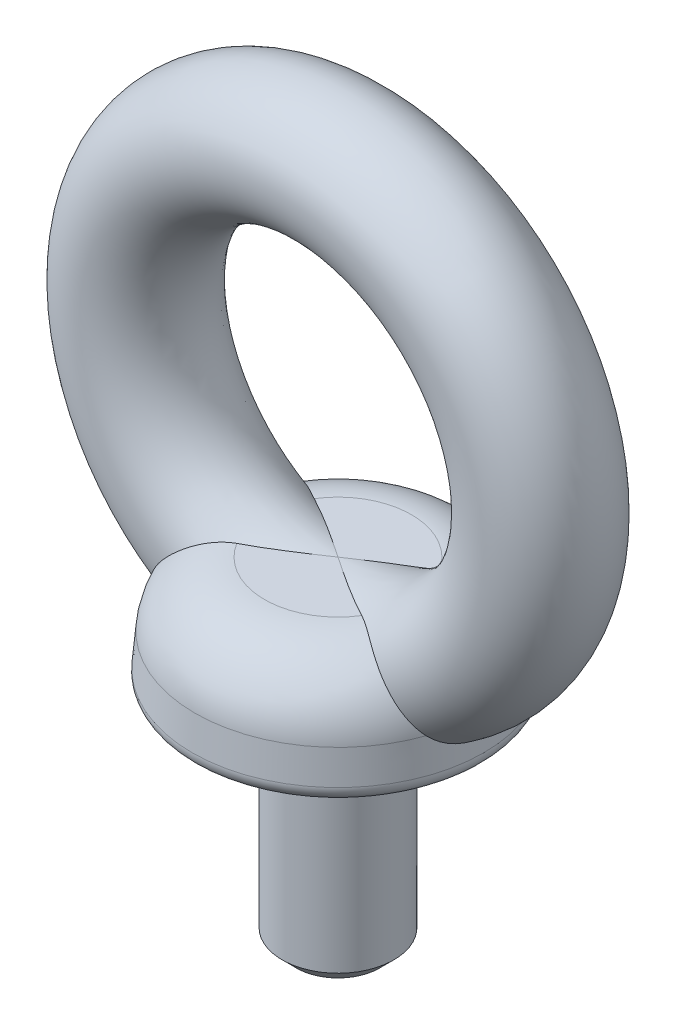
from build123d import *

# Parameters (mm, degrees)
SKETCH_1_R               = 10.55
EXTRUDE_1_DEPTH          = 8
EXTRUDE_1_TAPER          = 5
FILLET_1_R               = 5
SKETCH_3_R               = 4.5
CUT_EXTRUDE_1_DEPTH      = 8
CUT_EXTRUDE_1_DEPTH_BACK = 8
SKETCH_5_R               = 3
EXTRUDE_2_DEPTH          = 2
SKETCH_6_R               = 4
EXTRUDE_3_DEPTH          = 14
FILLET_2_R               = 1
CHAMFER_1_SIZE           = 1
SCALE_1_SCALE            = 0.25


with BuildPart() as part:
    # 草图1 → 拉伸1 (new body)
    with BuildSketch(Plane(origin=(0, 0, 0), x_dir=(1, 0, 0), z_dir=(0, 1, 0))):
        Circle(SKETCH_1_R)
    extrude(amount=EXTRUDE_1_DEPTH, taper=EXTRUDE_1_TAPER)

    # 圆角1
    fillet_1_edges = [part.edges().sort_by_distance(p)[0] for p in [
        (-9.850090692, 8, 0),
    ]]
    fillet(fillet_1_edges, radius=FILLET_1_R)

    # 扫描1: sweep along a path in 草图2
    with BuildLine(Plane.XY) as sweep_1_path:
        CenterArc((0, 18), 14.5, 0, 360)
    # 草图3 → 扫描1 (sweep)
    with BuildSketch(Plane(origin=(0, 0, 0), x_dir=(0, 0, -1), z_dir=(1, 0, 0))):
        with Locations((0, 32.5)):
            Circle(SKETCH_3_R)
    sweep(path=sweep_1_path.line)

    # 草图4 → 切除-拉伸1 (cut, two sides: drawn at the far end of the back side and taken through both)
    with BuildSketch(Plane.XY.offset(-CUT_EXTRUDE_1_DEPTH_BACK)):
        Polygon((0, 0), (10.55, 0), (10.55, -2.402486402), (-10.55, -2.402486402), (-10.55, 0), align=None)
    extrude(amount=CUT_EXTRUDE_1_DEPTH + CUT_EXTRUDE_1_DEPTH_BACK, mode=Mode.SUBTRACT)

    # 草图5 → 拉伸2 (add)
    with BuildSketch(Plane.XZ):
        with Locations(Location((0, 0, 0), (0, 0, 90))):
            Circle(SKETCH_5_R)
    extrude(amount=EXTRUDE_2_DEPTH)

    # 草图6 → 拉伸3 (add)
    with BuildSketch(Plane.XZ.offset(2)):
        with Locations(Location((0, 0, 0), (0, 0, 270))):
            Circle(SKETCH_6_R)
    extrude(amount=EXTRUDE_3_DEPTH)

    # 圆角2
    fillet_2_edges = [part.edges().sort_by_distance(p)[0] for p in [
        (-10.55, 0, 0),
        (0, 0, -3),
    ]]
    fillet(fillet_2_edges, radius=FILLET_2_R)

    # 倒角1
    chamfer_1_edges = [part.edges().sort_by_distance(p)[0] for p in [
        (0, -2, 4),
        (0, -16, 4),
    ]]
    chamfer(chamfer_1_edges, length=CHAMFER_1_SIZE - 0.0001)  # a hair under: the kernel refuses the full size


with BuildPart() as part_1:
    # 缩放比例1: scaled about (0, 0, 0)
    add(part.part.scale(SCALE_1_SCALE))


solid = part_1.part
